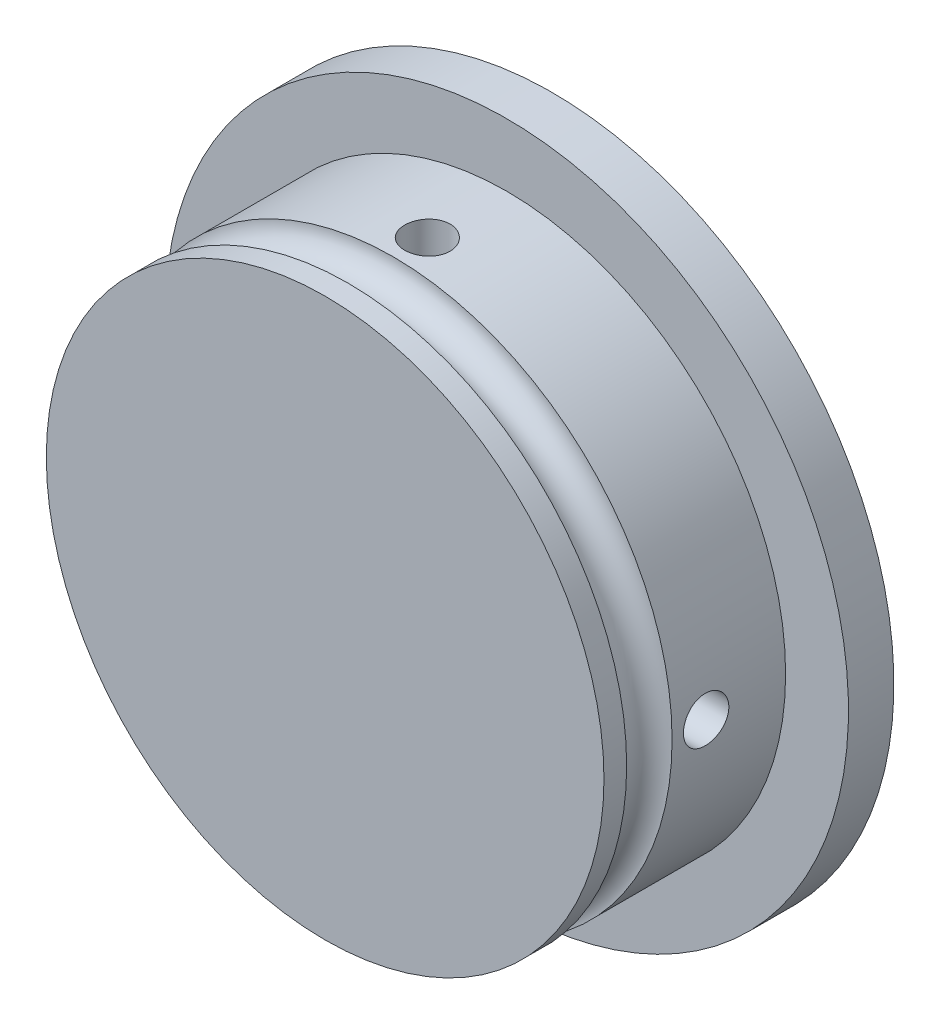
from build123d import *

# Parameters (mm, degrees)
F_4_0MM_DOWEL_HOLE2_D               = 4
F_4_0MM_DOWEL_HOLE2_DEPTH           = 8
F_4_0MM_DOWEL_HOLE2_TIP             = 1.201721238
F_4_0MM_DOWEL_HOLE2_ON_FACE_2_D     = 4
F_4_0MM_DOWEL_HOLE2_ON_FACE_2_DEPTH = 8
F_4_0MM_DOWEL_HOLE2_ON_FACE_2_TIP   = 1.201721238
F_4_0MM_DOWEL_HOLE2_ON_FACE_3_D     = 4
F_4_0MM_DOWEL_HOLE2_ON_FACE_3_DEPTH = 8
F_4_0MM_DOWEL_HOLE2_ON_FACE_3_TIP   = 1.201721238
F_4_0MM_DOWEL_HOLE2_ON_FACE_4_D     = 4
F_4_0MM_DOWEL_HOLE2_ON_FACE_4_DEPTH = 8
F_4_0MM_DOWEL_HOLE2_ON_FACE_4_TIP   = 1.201721238
F_6_0MM_DOWEL_HOLE1_D               = 6
F_6_0MM_DOWEL_HOLE1_DEPTH           = 15
F_6_0MM_DOWEL_HOLE1_TIP             = 1.802581857


with BuildPart() as part:
    # Sketch1 → Revolve1 (revolve)
    with BuildSketch(Plane(origin=(0, 0, 0), x_dir=(1, 0, 0), z_dir=(0, 1, 0))):
        with BuildLine():
            Line((0, 20), (0, 0))
            Line((0, 0), (24.5618, 0))
            Line((24.5618, 0), (24.5618, 2))
            ThreePointArc((24.5618, 2), (22.5618, 4), (24.5618, 6))
            Line((24.5618, 6), (24.5618, 16))
            Line((24.5618, 16), (30.099, 16))
            Line((30.099, 16), (30.099, 20))
            Line((30.099, 20), (0, 20))
        make_face()
    revolve(axis=Axis((0, 0, 0), (0, 0, 1)))

    # Ø4.0mm Dowel Hole2
    with Locations(Plane(origin=(0, -24.5618, -9), x_dir=(-1, 0, 0), z_dir=(0, -1, 0))):
        with Locations((0, 0)):
            Hole(F_4_0MM_DOWEL_HOLE2_D / 2, depth=F_4_0MM_DOWEL_HOLE2_DEPTH)
            with Locations((0, 0, -(F_4_0MM_DOWEL_HOLE2_DEPTH + F_4_0MM_DOWEL_HOLE2_TIP / 2))):  # 118° drill point
                Cone(0, F_4_0MM_DOWEL_HOLE2_D / 2, F_4_0MM_DOWEL_HOLE2_TIP, mode=Mode.SUBTRACT)

    # Ø4.0mm Dowel Hole2 on face 2
    with Locations(Plane(origin=(0, 24.5618, -9), x_dir=(0, 0, 1), z_dir=(0, 1, 0))):
        with Locations((0, 0)):
            Hole(F_4_0MM_DOWEL_HOLE2_ON_FACE_2_D / 2, depth=F_4_0MM_DOWEL_HOLE2_ON_FACE_2_DEPTH)
            with Locations((0, 0, -(F_4_0MM_DOWEL_HOLE2_ON_FACE_2_DEPTH + F_4_0MM_DOWEL_HOLE2_ON_FACE_2_TIP / 2))):  # 118° drill point
                Cone(0, F_4_0MM_DOWEL_HOLE2_ON_FACE_2_D / 2, F_4_0MM_DOWEL_HOLE2_ON_FACE_2_TIP, mode=Mode.SUBTRACT)

    # Ø4.0mm Dowel Hole2 on face 3
    with Locations(Plane(origin=(24.5618, 0, -9), x_dir=(0, 0, 1), z_dir=(1, 0, 0))):
        with Locations((0, 0)):
            Hole(F_4_0MM_DOWEL_HOLE2_ON_FACE_3_D / 2, depth=F_4_0MM_DOWEL_HOLE2_ON_FACE_3_DEPTH)
            with Locations((0, 0, -(F_4_0MM_DOWEL_HOLE2_ON_FACE_3_DEPTH + F_4_0MM_DOWEL_HOLE2_ON_FACE_3_TIP / 2))):  # 118° drill point
                Cone(0, F_4_0MM_DOWEL_HOLE2_ON_FACE_3_D / 2, F_4_0MM_DOWEL_HOLE2_ON_FACE_3_TIP, mode=Mode.SUBTRACT)

    # Ø4.0mm Dowel Hole2 on face 4
    with Locations(Plane(origin=(-24.5618, 0, -9), x_dir=(0, 0, -1), z_dir=(-1, 0, 0))):
        with Locations((0, 0)):
            Hole(F_4_0MM_DOWEL_HOLE2_ON_FACE_4_D / 2, depth=F_4_0MM_DOWEL_HOLE2_ON_FACE_4_DEPTH)
            with Locations((0, 0, -(F_4_0MM_DOWEL_HOLE2_ON_FACE_4_DEPTH + F_4_0MM_DOWEL_HOLE2_ON_FACE_4_TIP / 2))):  # 118° drill point
                Cone(0, F_4_0MM_DOWEL_HOLE2_ON_FACE_4_D / 2, F_4_0MM_DOWEL_HOLE2_ON_FACE_4_TIP, mode=Mode.SUBTRACT)

    # Ø6.0mm Dowel Hole1
    with Locations(Plane(origin=(0, 0, -20), x_dir=(-1, 0, 0), z_dir=(0, 0, -1))):
        with Locations((0, 0)):
            Hole(F_6_0MM_DOWEL_HOLE1_D / 2, depth=F_6_0MM_DOWEL_HOLE1_DEPTH)
            with Locations((0, 0, -(F_6_0MM_DOWEL_HOLE1_DEPTH + F_6_0MM_DOWEL_HOLE1_TIP / 2))):  # 118° drill point
                Cone(0, F_6_0MM_DOWEL_HOLE1_D / 2, F_6_0MM_DOWEL_HOLE1_TIP, mode=Mode.SUBTRACT)


solid = part.part
